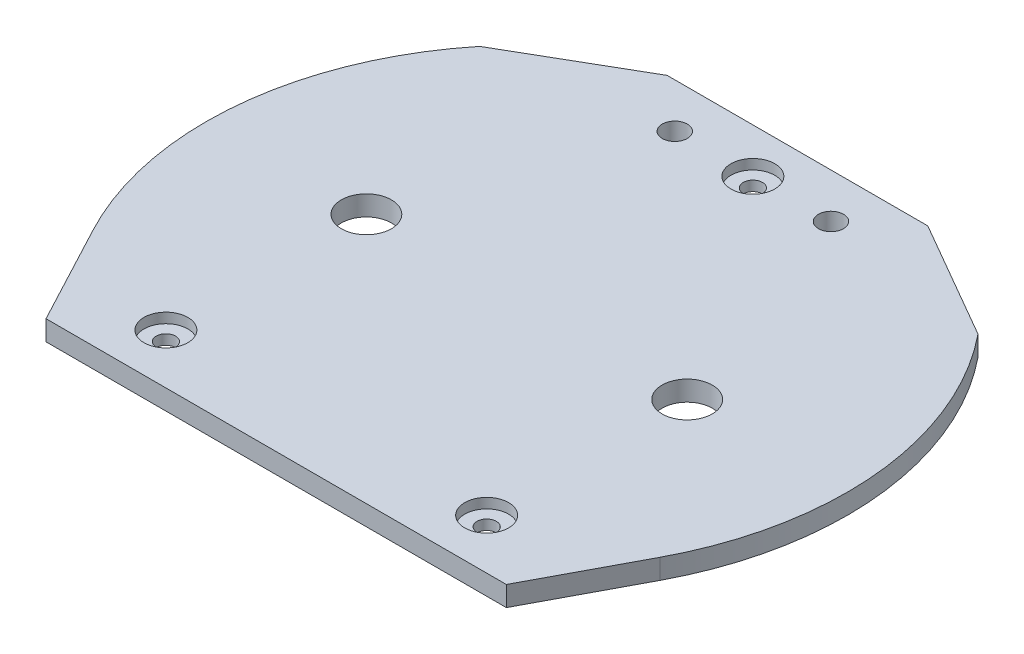
from build123d import *

# Parameters (mm, degrees)
SKETCH1_R                                           = 3.175
SKETCH1_R_2                                         = 1.5875
BOSS_EXTRUDE1_DEPTH                                 = 2.54
CBORE_FOR_2_BINDING_HEAD_MACHINE_SCREW1_D           = 2.4384
CBORE_FOR_2_BINDING_HEAD_MACHINE_SCREW1_CBORE_D     = 5.55752
CBORE_FOR_2_BINDING_HEAD_MACHINE_SCREW1_CBORE_DEPTH = 1.27


with BuildPart() as part:
    # Sketch1 → Boss-Extrude1 (new body)
    with BuildSketch(Plane(origin=(0, 0, 0), x_dir=(1, 0, 0), z_dir=(0, 1, 0))):
        with BuildLine():
            Line((16.51, 34.29), (-16.51, 34.29))
            Line((-16.51, 34.29), (-31.5650952, 25.597936734))
            ThreePointArc((-31.5650952, 25.597936734), (-40.449919494, 3.926017441), (-35.898566824, -19.05))
            Line((-35.898566824, -19.05), (-29.159161287, -31.75))
            Line((-29.159161287, -31.75), (29.159161287, -31.75))
            Line((29.159161287, -31.75), (35.898566824, -19.05))
            ThreePointArc((35.898566824, -19.05), (40.449919494, 3.926017441), (31.5650952, 25.597936734))
            Line((31.5650952, 25.597936734), (16.51, 34.29))
        make_face()
        with Locations((-20.32, 0)):
            Circle(SKETCH1_R, mode=Mode.SUBTRACT)
        with Locations((20.32, 0)):
            Circle(SKETCH1_R, mode=Mode.SUBTRACT)
        with Locations((-9.895226031, 28.641831082)):
            Circle(SKETCH1_R_2, mode=Mode.SUBTRACT)
        with Locations((9.895226031, 28.641831082)):
            Circle(SKETCH1_R_2, mode=Mode.SUBTRACT)
    extrude(amount=BOSS_EXTRUDE1_DEPTH)

    # CBORE for #2 Binding Head Machine Screw1 (through all)
    with Locations(Plane(origin=(0, 2.54, 0), x_dir=(1, 0, 0), z_dir=(0, 1, 0))):
        with Locations((-20.32, -25.4), (20.32, -25.4), (0, 28.641831082)):
            CounterBoreHole(CBORE_FOR_2_BINDING_HEAD_MACHINE_SCREW1_D / 2, CBORE_FOR_2_BINDING_HEAD_MACHINE_SCREW1_CBORE_D / 2, CBORE_FOR_2_BINDING_HEAD_MACHINE_SCREW1_CBORE_DEPTH)


solid = part.part
